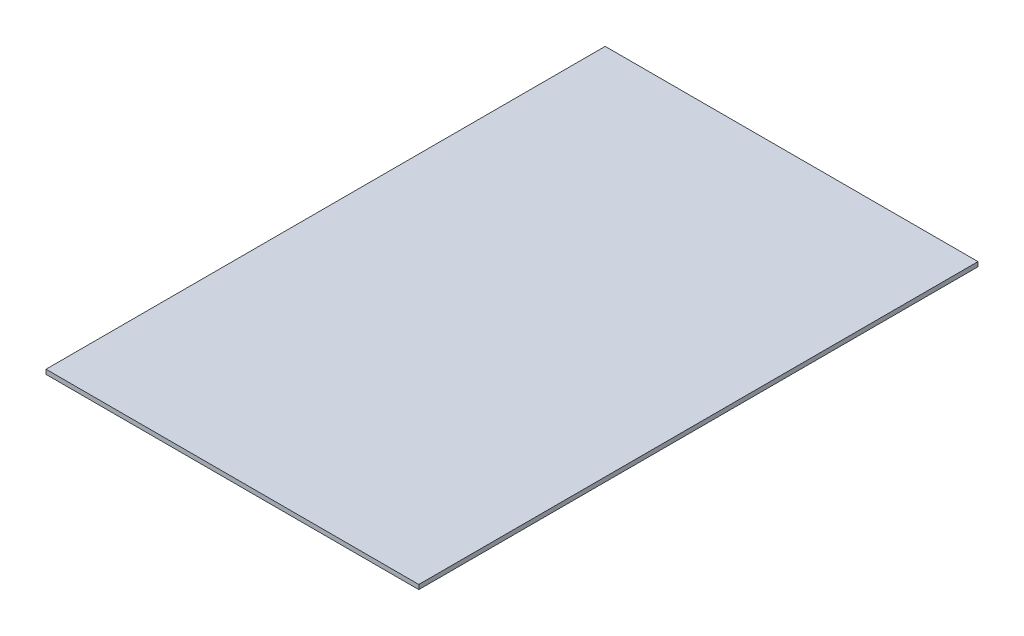
from build123d import *

# Parameters (mm, degrees)
SKETCH1_W           = 400
SKETCH1_H           = 600
BOSS_EXTRUDE1_DEPTH = 4.826


with BuildPart() as part:
    # Sketch1 → Boss-Extrude1 (new body)
    with BuildSketch(Plane(origin=(0, 0, 0), x_dir=(1, 0, 0), z_dir=(0, 1, 0))):
        with Locations((200, 300)):
            Rectangle(SKETCH1_W, SKETCH1_H)
    extrude(amount=BOSS_EXTRUDE1_DEPTH)


solid = part.part
